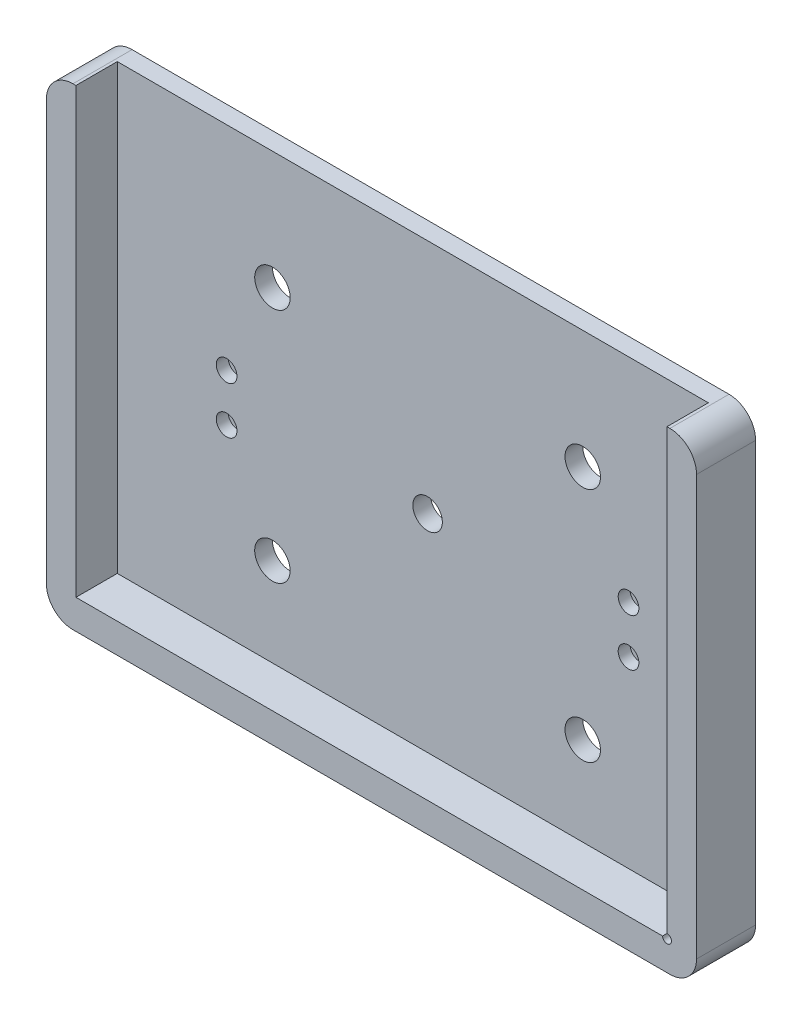
from build123d import *

# Parameters (mm, degrees)
ESQUISSE1_W             = 200
ESQUISSE1_H             = 150
BOSS_EXTRU_1_DEPTH      = 6
EXTRU_MINCE1_DEPTH      = 20
ESQUISSE3_R             = 6
ESQUISSE3_R_2           = 5
ENL_V_MAT_EXTRU_1_DEPTH = 20
COQUE1_T                = -2
NERVURE1_REACH          = 156.318
ESQUISSE5_WALL_W        = 365.835102668
ESQUISSE5_WALL_H        = 2
NERVURE2_REACH          = 167.297
ESQUISSE7_WALL_W        = 387.793585122
ESQUISSE7_WALL_H        = 2
NERVURE3_REACH          = 159.012
ESQUISSE10_WALL_W       = 379.451686112
ESQUISSE10_WALL_H       = 2
NERVURE4_REACH          = 168.674
ESQUISSE12_WALL_W       = 398.777025798
ESQUISSE12_WALL_H       = 2
ESQUISSE13_R            = 5.5
BOSS_EXTRU_3_DEPTH      = 6
ENL_V_START             = 6
ESQUISSE15_R            = 3.5
ENL_V_MAT_EXTRU_2_DEPTH = 4
ESQUISSE16_R            = 1.9
ENL_V_MAT_EXTRU_3_DEPTH = 166.71918738
NERVURE5_REACH          = 210.863
ESQUISSE18_WALL_W       = 441.77714252
ESQUISSE18_WALL_H       = 2
NERVURE6_REACH          = 207.957
ESQUISSE22_WALL_W       = 435.965957376
ESQUISSE22_WALL_H       = 2
NERVURE7_REACH          = 186.137
ESQUISSE23_WALL_W       = 459.286704882
ESQUISSE23_WALL_H       = 2
NERVURE8_REACH          = 206.554
ESQUISSE24_WALL_W       = 416.108160706
ESQUISSE24_WALL_H       = 2
NERVURE9_REACH          = 167.221
ESQUISSE26_WALL_W       = 383.451843928
ESQUISSE26_WALL_H       = 2
NERVURE10_REACH         = 167.221
ESQUISSE27_WALL_W       = 383.451843928
ESQUISSE27_WALL_H       = 2
NERVURE11_REACH         = 156.157
ESQUISSE28_WALL_W       = 361.32314275
ESQUISSE28_WALL_H       = 2
NERVURE12_REACH         = 156.157
ESQUISSE30_WALL_W       = 361.32314275
ESQUISSE30_WALL_H       = 2
NERVURE13_REACH         = 197.126
ESQUISSE32_WALL_W       = 414.315943848
ESQUISSE32_WALL_H       = 2
NERVURE14_REACH         = 197.677
ESQUISSE34_WALL_W       = 398.354710624
ESQUISSE34_WALL_H       = 2
NERVURE15_REACH         = 198.121
ESQUISSE35_WALL_W       = 416.32763442
ESQUISSE35_WALL_H       = 2
NERVURE16_REACH         = 186.143
ESQUISSE37_WALL_W       = 459.286942764
ESQUISSE37_WALL_H       = 2
NERVURE17_REACH         = 188.171
ESQUISSE38_WALL_W       = 451.059880704
ESQUISSE38_WALL_H       = 2
NERVURE19_REACH         = 187.552
ESQUISSE41_WALL_W       = 453.57821198
ESQUISSE41_WALL_H       = 2
NERVURE20_REACH         = 200.694
ESQUISSE43_WALL_W       = 474.838938468
ESQUISSE43_WALL_H       = 2
NERVURE21_REACH         = 203.571
ESQUISSE45_WALL_W       = 480.591576038
ESQUISSE45_WALL_H       = 2
CONG_1_R                = 1.75
CONG_2_R                = 1.75
CONG_3_R                = 1.75
CONG_4_R                = 1.75
CONG_5_R                = 1.75
CONG_6_R                = 1.75
CONG_8_R                = 1.75
CONG_9_R                = 1.75
CONG_10_R               = 1.75
CONG_13_R               = 1.75
CONG_14_R               = 1.75
CONG_15_R               = 1.75
CONG_16_R               = 1.75
CONG_17_R               = 1.75
CONG_18_R               = 1.75
CONG_19_R               = 1.75
CONG_20_R               = 1.75
CONG_21_R               = 1.75
CONG_22_R               = 1.75
CONG_23_R               = 1.75
CONG_24_R               = 1.75
CONG_25_R               = 1.75
CONG_26_R               = 1.75
CONG_27_R               = 1.75
CONG_28_R               = 1.75
CONG_29_R               = 1.75
CONG_30_R               = 1.75
CONG_31_R               = 1.75
CONG_32_R               = 1.75
CONG_33_R               = 1.75
CONG_34_R               = 1.75
CONG_35_R               = 1.75
CONG_36_R               = 1.75
CONG_37_R               = 1.75
CONG_38_R               = 1.75
CONG_39_R               = 1.75
CONG_40_R               = 1.75
CONG_41_R               = 1.75
CONG_42_R               = 1.75
CONG_43_R               = 1.75
CONG_44_R               = 1.75
CONG_45_R               = 1.75
CONG_46_R               = 1.75
CONG_47_R               = 1.75
CONG_48_R               = 1.75
CONG_49_R               = 1.75
CONG_50_R               = 1.75
CONG_51_R               = 1.75
CONG_52_R               = 1.75
CONG_53_R               = 9
CONG_54_R               = 9
ESQUISSE46_R            = 1.5
ENL_V_MAT_EXTRU_4_DEPTH = 166.102541064


with BuildPart() as part:
    # Esquisse1 → Boss.-Extru.1 (new body)
    with BuildSketch(Plane.XY):
        with Locations((28.223542423, -4.202586207)):
            Rectangle(ESQUISSE1_W, ESQUISSE1_H)
    extrude(amount=BOSS_EXTRU_1_DEPTH)

    # Esquisse2 → Extru.-Mince1 (add)
    with BuildSketch(Plane.XY):
        Polygon((138.223542423, 70.797413793), (138.223542423, -89.202586207), (-81.776457577, -89.202586207), (-81.776457577, 70.797413793), (-71.776457577, 70.797413793), (-71.776457577, -79.202586207), (128.223542423, -79.202586207), (128.223542423, 70.797413793), align=None)
    extrude(amount=EXTRU_MINCE1_DEPTH)

    # Esquisse3 → Enlèv. mat.-Extru.1 (cut)
    with BuildSketch(Plane.XY):
        with Locations((85.723542423, -49.202586207)):
            Circle(ESQUISSE3_R)
        with Locations((-19.289351877, -49.212412342)):
            Circle(ESQUISSE3_R)
        with Locations((85.723542423, 30.797413793)):
            Circle(ESQUISSE3_R)
        with Locations((-19.276454171, 30.824159225)):
            Circle(ESQUISSE3_R)
        with Locations((33.213351983, -9.202586207)):
            Circle(ESQUISSE3_R_2)
    extrude(amount=ENL_V_MAT_EXTRU_1_DEPTH, mode=Mode.SUBTRACT)

    # Coque1
    coque1_openings = [part.faces().sort_by_distance(p)[0] for p in [
        (28.14703655, -9.202641401, 0),
    ]]
    offset(amount=COQUE1_T, openings=coque1_openings, kind=Kind.INTERSECTION)

    # Esquisse5 wall → Nervure1 (add, up to next)
    with BuildSketch(Plane(origin=(114.169740953, 52.202474073, 0), x_dir=(0.799049632662, 0.601265070117, 0), z_dir=(0, 0, -1)), mode=Mode.PRIVATE) as nervure1_sk1:
        Rectangle(ESQUISSE5_WALL_W, ESQUISSE5_WALL_H)
    nervure1_tool1 = extrude(nervure1_sk1.sketch, amount=-NERVURE1_REACH, mode=Mode.PRIVATE) - part.part
    add(nervure1_tool1.solids().sort_by_distance((114.169740953, 52.202474073, 0))[0])

    # Esquisse7 wall → Nervure2 (add, up to next)
    with BuildSketch(Plane(origin=(114.169740953, -70.607646488, 0), x_dir=(0.799049632662, -0.601265070117, 0), z_dir=(0, 0, -1)), mode=Mode.PRIVATE) as nervure2_sk1:
        Rectangle(ESQUISSE7_WALL_W, ESQUISSE7_WALL_H)
    nervure2_tool1 = extrude(nervure2_sk1.sketch, amount=-NERVURE2_REACH, mode=Mode.PRIVATE) - part.part
    add(nervure2_tool1.solids().sort_by_distance((114.169740953, -70.607646488, 0))[0])

    # Esquisse10 wall → Nervure3 (add, up to next)
    with BuildSketch(Plane(origin=(-52.920215029, -70.334969349, 0), x_dir=(-0.846827575434, -0.531867518734, 0), z_dir=(0, 0, -1)), mode=Mode.PRIVATE) as nervure3_sk1:
        Rectangle(ESQUISSE10_WALL_W, ESQUISSE10_WALL_H)
    nervure3_tool1 = extrude(nervure3_sk1.sketch, amount=-NERVURE3_REACH, mode=Mode.PRIVATE) - part.part
    add(nervure3_tool1.solids().sort_by_distance((-52.920215029, -70.334969349, 0))[0])

    # Esquisse12 wall → Nervure4 (add, up to next)
    with BuildSketch(Plane(origin=(-52.914397079, 51.937251743, 0), x_dir=(-0.846985301367, 0.531616308316, 0), z_dir=(0, 0, -1)), mode=Mode.PRIVATE) as nervure4_sk1:
        Rectangle(ESQUISSE12_WALL_W, ESQUISSE12_WALL_H)
    nervure4_tool1 = extrude(nervure4_sk1.sketch, amount=-NERVURE4_REACH, mode=Mode.PRIVATE) - part.part
    add(nervure4_tool1.solids().sort_by_distance((-52.914397079, 51.937251743, 0))[0])

    # Esquisse13 → Boss.-Extru.3 (add)
    with BuildSketch(Plane.XY):
        with Locations((101.213351983, -17.202586207)):
            Circle(ESQUISSE13_R)
        with Locations((101.213351983, -1.202586207)):
            Circle(ESQUISSE13_R)
        with Locations((-34.786648017, -17.202586207)):
            Circle(ESQUISSE13_R)
        with Locations((-34.786648017, -1.202586207)):
            Circle(ESQUISSE13_R)
    extrude(amount=BOSS_EXTRU_3_DEPTH)

    # Esquisse15 → Enlèv. mat.-Extru.2 (cut)
    with BuildSketch(Plane.XY.offset(ENL_V_START)):
        with Locations((-34.786648017, -17.202586207)):
            Circle(ESQUISSE15_R)
        with Locations((-34.786648017, -1.202586207)):
            Circle(ESQUISSE15_R)
        with Locations((101.213351983, -17.202586207)):
            Circle(ESQUISSE15_R)
        with Locations((101.213351983, -1.202586207)):
            Circle(ESQUISSE15_R)
    extrude(amount=-ENL_V_MAT_EXTRU_2_DEPTH, mode=Mode.SUBTRACT)

    # Esquisse16 → Enlèv. mat.-Extru.3 (cut, through all)
    with BuildSketch(Plane.XY):
        with Locations((101.213351983, -17.202586207)):
            Circle(ESQUISSE16_R)
        with Locations((101.213351983, -1.202586207)):
            Circle(ESQUISSE16_R)
        with Locations((-34.786648017, -1.202586207)):
            Circle(ESQUISSE16_R)
        with Locations((-34.786648017, -17.202586207)):
            Circle(ESQUISSE16_R)
    extrude(amount=ENL_V_MAT_EXTRU_3_DEPTH, mode=Mode.SUBTRACT)

    # Esquisse18 wall → Nervure5 (add, up to next)
    with BuildSketch(Plane(origin=(94.013067546, 13.672296607, 0), x_dir=(0.435696273718, -0.900093749044, 0), z_dir=(0, 0, 1)), mode=Mode.PRIVATE) as nervure5_sk1:
        Rectangle(ESQUISSE18_WALL_W, ESQUISSE18_WALL_H)
    nervure5_tool1 = extrude(nervure5_sk1.sketch, amount=NERVURE5_REACH, mode=Mode.PRIVATE) - part.part
    add(nervure5_tool1.solids().sort_by_distance((94.013067546, 13.672296607, 0))[0])

    # Esquisse22 wall → Nervure6 (add, up to next)
    with BuildSketch(Plane(origin=(94.013067546, -32.077469021, 0), x_dir=(-0.435696273718, -0.900093749044, 0), z_dir=(0, 0, -1)), mode=Mode.PRIVATE) as nervure6_sk1:
        Rectangle(ESQUISSE22_WALL_W, ESQUISSE22_WALL_H)
    nervure6_tool1 = extrude(nervure6_sk1.sketch, amount=-NERVURE6_REACH, mode=Mode.PRIVATE) - part.part
    add(nervure6_tool1.solids().sort_by_distance((94.013067546, -32.077469021, 0))[0])

    # Esquisse23 wall → Nervure7 (add, up to next)
    with BuildSketch(Plane(origin=(33.217095273, -49.207499275, 0), x_dir=(-0.999999995622, -9.3570746e-05, 0), z_dir=(0, 0, 1)), mode=Mode.PRIVATE) as nervure7_sk1:
        Rectangle(ESQUISSE23_WALL_W, ESQUISSE23_WALL_H)
    nervure7_tool1 = extrude(nervure7_sk1.sketch, amount=NERVURE7_REACH, mode=Mode.PRIVATE) - part.part
    add(nervure7_tool1.solids().sort_by_distance((33.217095273, -49.207499275, 0))[0])

    # Esquisse24 wall → Nervure8 (add, up to next)
    with BuildSketch(Plane(origin=(101.213351983, -9.202586207, 0), x_dir=(0, -1, 0), z_dir=(0, 0, 1)), mode=Mode.PRIVATE) as nervure8_sk1:
        Rectangle(ESQUISSE24_WALL_W, ESQUISSE24_WALL_H)
    nervure8_tool1 = extrude(nervure8_sk1.sketch, amount=NERVURE8_REACH, mode=Mode.PRIVATE) - part.part
    add(nervure8_tool1.solids().sort_by_distance((101.213351983, -9.202586207, 0))[0])

    # Esquisse26 wall → Nervure9 (add, up to next)
    with BuildSketch(Plane(origin=(59.075868223, -28.892808029, 0), x_dir=(-0.795334040293, 0.606171398494, 0), z_dir=(0, 0, -1)), mode=Mode.PRIVATE) as nervure9_sk1:
        Rectangle(ESQUISSE26_WALL_W, ESQUISSE26_WALL_H)
    nervure9_tool1 = extrude(nervure9_sk1.sketch, amount=-NERVURE9_REACH, mode=Mode.PRIVATE) - part.part
    add(nervure9_tool1.solids().sort_by_distance((59.075868223, -28.892808029, 0))[0])

    # Esquisse27 wall → Nervure10 (add, up to next)
    with BuildSketch(Plane(origin=(7.371220028, 10.514381047, 0), x_dir=(-0.795334040302, 0.606171398481, 0), z_dir=(0, 0, -1)), mode=Mode.PRIVATE) as nervure10_sk1:
        Rectangle(ESQUISSE27_WALL_W, ESQUISSE27_WALL_H)
    nervure10_tool1 = extrude(nervure10_sk1.sketch, amount=-NERVURE10_REACH, mode=Mode.PRIVATE) - part.part
    add(nervure10_tool1.solids().sort_by_distance((7.371220028, 10.514381047, 0))[0])

    # Esquisse28 wall → Nervure11 (add, up to next)
    with BuildSketch(Plane(origin=(59.072601908, 10.491934821, 0), x_dir=(-0.795431713068, -0.606043224404, 0), z_dir=(0, 0, 1)), mode=Mode.PRIVATE) as nervure11_sk1:
        Rectangle(ESQUISSE28_WALL_W, ESQUISSE28_WALL_H)
    nervure11_tool1 = extrude(nervure11_sk1.sketch, amount=NERVURE11_REACH, mode=Mode.PRIVATE) - part.part
    add(nervure11_tool1.solids().sort_by_distance((59.072601908, 10.491934821, 0))[0])

    # Esquisse30 wall → Nervure12 (add, up to next)
    with BuildSketch(Plane(origin=(7.361588639, -28.90693337, 0), x_dir=(-0.795431713068, -0.606043224404, 0), z_dir=(0, 0, 1)), mode=Mode.PRIVATE) as nervure12_sk1:
        Rectangle(ESQUISSE30_WALL_W, ESQUISSE30_WALL_H)
    nervure12_tool1 = extrude(nervure12_sk1.sketch, amount=NERVURE12_REACH, mode=Mode.PRIVATE) - part.part
    add(nervure12_tool1.solids().sort_by_distance((7.361588639, -28.90693337, 0))[0])

    # Esquisse32 wall → Nervure13 (add, up to next)
    with BuildSketch(Plane(origin=(-27.582698031, -32.082419723, 0), x_dir=(0.435758467728, -0.900063640974, 0), z_dir=(0, 0, 1)), mode=Mode.PRIVATE) as nervure13_sk1:
        Rectangle(ESQUISSE32_WALL_W, ESQUISSE32_WALL_H)
    nervure13_tool1 = extrude(nervure13_sk1.sketch, amount=NERVURE13_REACH, mode=Mode.PRIVATE) - part.part
    add(nervure13_tool1.solids().sort_by_distance((-27.582698031, -32.082419723, 0))[0])

    # Esquisse34 wall → Nervure14 (add, up to next)
    with BuildSketch(Plane(origin=(-34.786648017, -9.202586207, 0), x_dir=(0, -1, 0), z_dir=(0, 0, 1)), mode=Mode.PRIVATE) as nervure14_sk1:
        Rectangle(ESQUISSE34_WALL_W, ESQUISSE34_WALL_H)
    nervure14_tool1 = extrude(nervure14_sk1.sketch, amount=NERVURE14_REACH, mode=Mode.PRIVATE) - part.part
    add(nervure14_tool1.solids().sort_by_distance((-34.786648017, -9.202586207, 0))[0])

    # Esquisse35 wall → Nervure15 (add, up to next)
    with BuildSketch(Plane(origin=(-27.576383104, 13.685771807, 0), x_dir=(-0.435865608605, -0.900011761721, 0), z_dir=(0, 0, -1)), mode=Mode.PRIVATE) as nervure15_sk1:
        Rectangle(ESQUISSE35_WALL_W, ESQUISSE35_WALL_H)
    nervure15_tool1 = extrude(nervure15_sk1.sketch, amount=-NERVURE15_REACH, mode=Mode.PRIVATE) - part.part
    add(nervure15_tool1.solids().sort_by_distance((-27.576383104, 13.685771807, 0))[0])

    # Esquisse37 wall → Nervure16 (add, up to next)
    with BuildSketch(Plane(origin=(33.223544126, 30.810786509, 0), x_dir=(-0.999999967559, 0.000254718404, 0), z_dir=(0, 0, 1)), mode=Mode.PRIVATE) as nervure16_sk1:
        Rectangle(ESQUISSE37_WALL_W, ESQUISSE37_WALL_H)
    nervure16_tool1 = extrude(nervure16_sk1.sketch, amount=NERVURE16_REACH, mode=Mode.PRIVATE) - part.part
    add(nervure16_tool1.solids().sort_by_distance((33.223544126, 30.810786509, 0))[0])

    # Esquisse38 wall → Nervure17 (add, up to next)
    with BuildSketch(Plane(origin=(-58.499898007, 35.693046729, 0), x_dir=(-0.540670934544, 0.841234176992, 0), z_dir=(0, 0, 1)), mode=Mode.PRIVATE) as nervure17_sk1:
        Rectangle(ESQUISSE38_WALL_W, ESQUISSE38_WALL_H)
    nervure17_tool1 = extrude(nervure17_sk1.sketch, amount=NERVURE17_REACH, mode=Mode.PRIVATE) - part.part
    add(nervure17_tool1.solids().sort_by_distance((-58.499898007, 35.693046729, 0))[0])

    # Esquisse41 wall → Nervure19 (add, up to next)
    with BuildSketch(Plane(origin=(-59.515553795, -55.678486003, 0), x_dir=(-0.540670934543, -0.841234176992, 0), z_dir=(0, 0, -1)), mode=Mode.PRIVATE) as nervure19_sk1:
        Rectangle(ESQUISSE41_WALL_W, ESQUISSE41_WALL_H)
    nervure19_tool1 = extrude(nervure19_sk1.sketch, amount=-NERVURE19_REACH, mode=Mode.PRIVATE) - part.part
    add(nervure19_tool1.solids().sort_by_distance((-59.515553795, -55.678486003, 0))[0])

    # Esquisse43 wall → Nervure20 (add, up to next)
    with BuildSketch(Plane(origin=(120.54873406, 37.456922021, 0), x_dir=(-0.447317753331, -0.894375104503, 0), z_dir=(0, 0, 1)), mode=Mode.PRIVATE) as nervure20_sk1:
        Rectangle(ESQUISSE43_WALL_W, ESQUISSE43_WALL_H)
    nervure20_tool1 = extrude(nervure20_sk1.sketch, amount=NERVURE20_REACH, mode=Mode.PRIVATE) - part.part
    add(nervure20_tool1.solids().sort_by_distance((120.54873406, 37.456922021, 0))[0])

    # Esquisse45 wall → Nervure21 (add, up to next)
    with BuildSketch(Plane(origin=(120.54873406, -55.862094434, 0), x_dir=(0.447317753331, -0.894375104503, 0), z_dir=(0, 0, -1)), mode=Mode.PRIVATE) as nervure21_sk1:
        Rectangle(ESQUISSE45_WALL_W, ESQUISSE45_WALL_H)
    nervure21_tool1 = extrude(nervure21_sk1.sketch, amount=-NERVURE21_REACH, mode=Mode.PRIVATE) - part.part
    add(nervure21_tool1.solids().sort_by_distance((120.54873406, -55.862094434, 0))[0])

    # Congé1
    cong_1_edges = [part.edges().sort_by_distance(p)[0] for p in [
        (-79.776457577, 66.947859961, 9),
    ]]
    fillet(cong_1_edges, radius=CONG_1_R)

    # Congé2
    cong_2_edges = [part.edges().sort_by_distance(p)[0] for p in [
        (-76.512025419, 65.567811854, 9),
    ]]
    fillet(cong_2_edges, radius=CONG_2_R)

    # Congé3
    cong_3_edges = [part.edges().sort_by_distance(p)[0] for p in [
        (-77.895401663, 68.797413793, 9),
    ]]
    fillet(cong_3_edges, radius=CONG_3_R)

    # Congé4
    cong_4_edges = [part.edges().sort_by_distance(p)[0] for p in [
        (-79.776457577, -85.353032373, 9),
    ]]
    fillet(cong_4_edges, radius=CONG_4_R)

    # Congé5
    cong_5_edges = [part.edges().sort_by_distance(p)[0] for p in [
        (-76.510333398, -83.970351638, 9),
    ]]
    fillet(cong_5_edges, radius=CONG_5_R)

    # Congé6
    cong_6_edges = [part.edges().sort_by_distance(p)[0] for p in [
        (-77.896290121, -87.202586207, 9),
    ]]
    fillet(cong_6_edges, radius=CONG_6_R)

    # Congé8
    cong_8_edges = [part.edges().sort_by_distance(p)[0] for p in [
        (134.560382445, -87.202586207, 9),
    ]]
    fillet(cong_8_edges, radius=CONG_8_R)

    # Congé9
    # the kernel refuses this fillet: 1.75 mm, written as the material it adds along each edge
    with BuildSketch(Plane(origin=(133.427075295, -83.846827198, 18), x_dir=(-0.7990496326619738, 0.60126507011697, 0), z_dir=(0, 0, -1))) as cong_9_piece_1:
        with BuildLine():
            CenterArc((CONG_9_R * 4.25221670969, CONG_9_R), CONG_9_R, 116.467720972, 153.532279028)
            Line((CONG_9_R * 3.80652315129, CONG_9_R * 1.8951855964), (0, 0))
            Line((0, 0), (CONG_9_R * 4.25221670969, 0))
        make_face()
    extrude(amount=18)

    # Congé10
    cong_10_edges = [part.edges().sort_by_distance(p)[0] for p in [
        (136.223542423, -84.967038896, 9),
    ]]
    fillet(cong_10_edges, radius=CONG_10_R)

    # Congé13
    # the kernel refuses this fillet: 1.75 mm, written as the material it adds along each edge
    with BuildSketch(Plane(origin=(134.560382447, 68.797413793, 18), x_dir=(-1, 0, 0), z_dir=(0, 0, -1))) as cong_13_piece_1:
        with BuildLine():
            CenterArc((CONG_13_R * 2.99210734512, -CONG_13_R), CONG_13_R, 90, 143.039444551)
            Line((CONG_13_R * 2.390842275, -CONG_13_R * 1.79904963266), (0, 0))
            Line((0, 0), (CONG_13_R * 2.99210734512, 0))
        make_face()
    extrude(amount=18)

    # Congé14
    # the kernel refuses this fillet: 1.75 mm, written as the material it adds along each edge
    with BuildSketch(Plane(origin=(133.427075293, 65.441654782, 36.603448105), x_dir=(-0.7990496326619738, -0.60126507011697, 0), z_dir=(0, 0, -1))) as cong_14_piece_1_section:
        with BuildLine():
            CenterArc((CONG_14_R * 4.25221670969, -CONG_14_R), CONG_14_R, 90, 153.532279028)
            Line((CONG_14_R * 3.80652315129, -CONG_14_R * 1.8951855964), (0, 0))
            Line((0, 0), (CONG_14_R * 4.25221670969, 0))
        make_face()
    cong_14_piece_1 = extrude(amount=36.603448105, mode=Mode.PRIVATE)
    cong_14_piece_1 = split(cong_14_piece_1, bisect_by=Plane(origin=(133.427075293, 65.441654782, 20), z_dir=(0, 0, -1)), keep=Keep.TOP, mode=Mode.PRIVATE)
    cong_14_piece_1 = split(cong_14_piece_1, bisect_by=Plane(origin=(128.223542423, 65.441654782, 36.603448105), z_dir=(1, 0, 0)), keep=Keep.TOP, mode=Mode.PRIVATE)
    add(cong_14_piece_1)
    with BuildSketch(Plane(origin=(133.427075293, 65.441654782, 36.603448105), x_dir=(-0.7990496326619738, -0.60126507011697, 0), z_dir=(0, 0, -1))) as cong_14_piece_2_section:
        with BuildLine():
            CenterArc((CONG_14_R * 4.25221670969, -CONG_14_R), CONG_14_R, 90, 153.532279028)
            Line((CONG_14_R * 3.80652315129, -CONG_14_R * 1.8951855964), (0, 0))
            Line((0, 0), (CONG_14_R * 4.25221670969, 0))
        make_face()
    cong_14_piece_2 = extrude(amount=36.603448105, mode=Mode.PRIVATE)
    cong_14_piece_2 = split(cong_14_piece_2, bisect_by=Plane(origin=(133.427075293, 65.441654782, 6), z_dir=(0, 0, -1)), keep=Keep.TOP, mode=Mode.PRIVATE)
    add(cong_14_piece_2)

    # Congé15
    cong_15_edges = [part.edges().sort_by_distance(p)[0] for p in [
        (136.223542423, 66.561866483, 9),
    ]]
    fillet(cong_15_edges, radius=CONG_15_R)

    # Congé16
    cong_16_edges = [part.edges().sort_by_distance(p)[0] for p in [
        (104.526967732, 3.187168988, 2),
    ]]
    fillet(cong_16_edges, radius=CONG_16_R)

    # Congé17
    cong_17_edges = [part.edges().sort_by_distance(p)[0] for p in [
        (102.738217523, 4.081804495, 2),
    ]]
    fillet(cong_17_edges, radius=CONG_17_R)

    # Congé18
    cong_18_edges = [part.edges().sort_by_distance(p)[0] for p in [
        (99.75705785, 4.101111314, 2),
    ]]
    fillet(cong_18_edges, radius=CONG_18_R)

    # Congé19
    cong_19_edges = [part.edges().sort_by_distance(p)[0] for p in [
        (97.956870352, 3.229718767, 2),
    ]]
    fillet(cong_19_edges, radius=CONG_19_R)

    # Congé20
    cong_20_edges = [part.edges().sort_by_distance(p)[0] for p in [
        (100.213351983, -6.61091312, 2),
    ]]
    fillet(cong_20_edges, radius=CONG_20_R)

    # Congé21
    cong_21_edges = [part.edges().sort_by_distance(p)[0] for p in [
        (102.213351983, -6.61091312, 2),
    ]]
    fillet(cong_21_edges, radius=CONG_21_R)

    # Congé22
    cong_22_edges = [part.edges().sort_by_distance(p)[0] for p in [
        (102.213351983, -11.794259294, 2),
    ]]
    fillet(cong_22_edges, radius=CONG_22_R)

    # Congé23
    cong_23_edges = [part.edges().sort_by_distance(p)[0] for p in [
        (104.526967732, -21.592341401, 2),
    ]]
    fillet(cong_23_edges, radius=CONG_23_R)

    # Congé24
    cong_24_edges = [part.edges().sort_by_distance(p)[0] for p in [
        (102.738217523, -22.486976908, 2),
    ]]
    fillet(cong_24_edges, radius=CONG_24_R)

    # Congé25
    cong_25_edges = [part.edges().sort_by_distance(p)[0] for p in [
        (97.956870352, -21.634891181, 2),
    ]]
    fillet(cong_25_edges, radius=CONG_25_R)

    # Congé26
    cong_26_edges = [part.edges().sort_by_distance(p)[0] for p in [
        (100.213351983, -11.794259294, 2),
    ]]
    fillet(cong_26_edges, radius=CONG_26_R)

    # Congé27
    cong_27_edges = [part.edges().sort_by_distance(p)[0] for p in [
        (99.75705785, -22.506283728, 2),
    ]]
    fillet(cong_27_edges, radius=CONG_27_R)

    # Congé28
    cong_28_edges = [part.edges().sort_by_distance(p)[0] for p in [
        (90.081868135, -42.494009831, 2),
    ]]
    fillet(cong_28_edges, radius=CONG_28_R)

    # Congé29
    cong_29_edges = [part.edges().sort_by_distance(p)[0] for p in [
        (92.667067332, -53.175930118, 2),
    ]]
    fillet(cong_29_edges, radius=CONG_29_R)

    # Congé30
    cong_30_edges = [part.edges().sort_by_distance(p)[0] for p in [
        (91.464537192, -54.774029383, 2),
    ]]
    fillet(cong_30_edges, radius=CONG_30_R)

    # Congé31
    cong_31_edges = [part.edges().sort_by_distance(p)[0] for p in [
        (77.786382095, -50.203328898, 2),
    ]]
    fillet(cong_31_edges, radius=CONG_31_R)

    # Congé32
    cong_32_edges = [part.edges().sort_by_distance(p)[0] for p in [
        (77.786194954, -48.203328907, 2),
    ]]
    fillet(cong_32_edges, radius=CONG_32_R)

    # Congé33
    cong_33_edges = [part.edges().sort_by_distance(p)[0] for p in [
        (78.804602785, -45.186583931, 2),
    ]]
    fillet(cong_33_edges, radius=CONG_33_R)

    # Congé34
    cong_34_edges = [part.edges().sort_by_distance(p)[0] for p in [
        (80.016945581, -43.59591585, 2),
    ]]
    fillet(cong_34_edges, radius=CONG_34_R)

    # Congé35
    cong_35_edges = [part.edges().sort_by_distance(p)[0] for p in [
        (-11.352004407, -50.211669643, 2),
    ]]
    fillet(cong_35_edges, radius=CONG_35_R)

    # Congé36
    cong_36_edges = [part.edges().sort_by_distance(p)[0] for p in [
        (-25.478969862, -54.280807472, 2),
    ]]
    fillet(cong_36_edges, radius=CONG_36_R)

    # Congé37
    cong_37_edges = [part.edges().sort_by_distance(p)[0] for p in [
        (-26.5427049, -52.587152321, 2),
    ]]
    fillet(cong_37_edges, radius=CONG_37_R)

    # Congé38
    cong_38_edges = [part.edges().sort_by_distance(p)[0] for p in [
        (-23.648141129, -42.504137135, 2),
    ]]
    fillet(cong_38_edges, radius=CONG_38_R)

    # Congé39
    cong_39_edges = [part.edges().sort_by_distance(p)[0] for p in [
        (-33.329987409, -22.506183088, 2),
    ]]
    fillet(cong_39_edges, radius=CONG_39_R)

    # Congé40
    cong_40_edges = [part.edges().sort_by_distance(p)[0] for p in [
        (-36.869539006, -22.292926581, 2),
    ]]
    fillet(cong_40_edges, radius=CONG_40_R)

    # Congé41
    cong_41_edges = [part.edges().sort_by_distance(p)[0] for p in [
        (-38.55200736, -21.211584712, 2),
    ]]
    fillet(cong_41_edges, radius=CONG_41_R)

    # Congé42
    cong_42_edges = [part.edges().sort_by_distance(p)[0] for p in [
        (-35.786648017, -11.794259294, 2),
    ]]
    fillet(cong_42_edges, radius=CONG_42_R)

    # Congé43
    cong_43_edges = [part.edges().sort_by_distance(p)[0] for p in [
        (-31.529860127, -21.634666152, 2),
    ]]
    fillet(cong_43_edges, radius=CONG_43_R)

    # Congé44
    cong_44_edges = [part.edges().sort_by_distance(p)[0] for p in [
        (-33.786648017, -11.794259294, 2),
    ]]
    fillet(cong_44_edges, radius=CONG_44_R)

    # Congé45
    cong_45_edges = [part.edges().sort_by_distance(p)[0] for p in [
        (-33.786648017, -6.61091312, 2),
    ]]
    fillet(cong_45_edges, radius=CONG_45_R)

    # Congé46
    cong_46_edges = [part.edges().sort_by_distance(p)[0] for p in [
        (-31.529332554, 3.229106018, 2),
    ]]
    fillet(cong_46_edges, radius=CONG_46_R)

    # Congé47
    cong_47_edges = [part.edges().sort_by_distance(p)[0] for p in [
        (-21.836018424, 23.244671721, 2),
    ]]
    fillet(cong_47_edges, radius=CONG_47_R)

    # Congé48
    cong_48_edges = [part.edges().sort_by_distance(p)[0] for p in [
        (-13.56985733, 25.217488868, 2),
    ]]
    fillet(cong_48_edges, radius=CONG_48_R)

    # Congé49
    cong_49_edges = [part.edges().sort_by_distance(p)[0] for p in [
        (27.105223234, -5.783410402, 2),
        (27.09943258, -12.611396781, 2),
    ]]
    fillet(cong_49_edges, radius=CONG_49_R)

    # Congé50
    cong_50_edges = [part.edges().sort_by_distance(p)[0] for p in [
        (38.12952222, -14.185684661, 2),
        (28.321426413, -4.195684548, 2),
        (39.333339685, -5.804682364, 2),
        (80.016042154, 25.191663113, 2),
        (78.803955706, 26.782526539, 2),
        (38.122671518, -4.212738343, 2),
        (-12.369765159, -45.197525089, 2),
        (28.31293731, -14.201179612, 2),
        (-13.581851608, -43.606661663, 2),
        (-21.848013847, -41.6326202, 2),
        (91.464537192, 36.368856968, 2),
        (92.667067333, 34.770757703, 2),
        (77.786034029, 29.79943559, 2),
        (77.786543466, 31.799435525, 2),
        (88.281680637, 23.21744487, 2),
        (-11.352191549, -48.211669652, 2),
        (39.338004635, -12.592074353, 2),
    ]]
    fillet(cong_50_edges, radius=CONG_50_R)

    # Congé51
    cong_51_edges = [part.edges().sort_by_distance(p)[0] for p in [
        (-35.786648017, -6.61091312, 2),
        (-23.636041948, 24.116402938, 2),
        (-33.329356077, 4.100837235, 2),
        (-11.338945777, 31.822137428, 2),
        (-36.869539006, 3.887754168, 2),
        (-38.55200736, 2.806412299, 2),
        (-26.530807894, 34.196747559, 2),
        (-25.467575277, 35.890718161, 2),
    ]]
    fillet(cong_51_edges, radius=CONG_51_R)

    # Congé52
    cong_52_edges = [part.edges().sort_by_distance(p)[0] for p in [
        (-73.776457577, 57.612412576, 11),
        (-73.776457577, -76.017584989, 11),
        (130.223542423, 54.565359331, 11),
        (130.223542423, -72.970531744, 11),
        (126.586698234, -81.202586207, 11),
        (-68.343224229, -81.202586207, 11),
    ]]
    fillet(cong_52_edges, radius=CONG_52_R)

    # Congé53
    cong_53_edges = [part.edges().sort_by_distance(p)[0] for p in [
        (138.223542423, 70.797413793, 10),
    ]]
    fillet(cong_53_edges, radius=CONG_53_R)

    # Congé54
    cong_54_edges = [part.edges().sort_by_distance(p)[0] for p in [
        (-81.776457577, 70.797413793, 10),
        (-81.776457577, -89.202586207, 10),
        (138.223542423, -89.202586207, 10),
    ]]
    fillet(cong_54_edges, radius=CONG_54_R)

    # Esquisse46 → Enlèv. mat.-Extru.4 (cut, through all)
    with BuildSketch(Plane.XY.offset(6)):
        with Locations((128.223542423, -79.202586207)):
            Circle(ESQUISSE46_R)
    extrude(amount=ENL_V_MAT_EXTRU_4_DEPTH, mode=Mode.SUBTRACT)


solid = part.part
